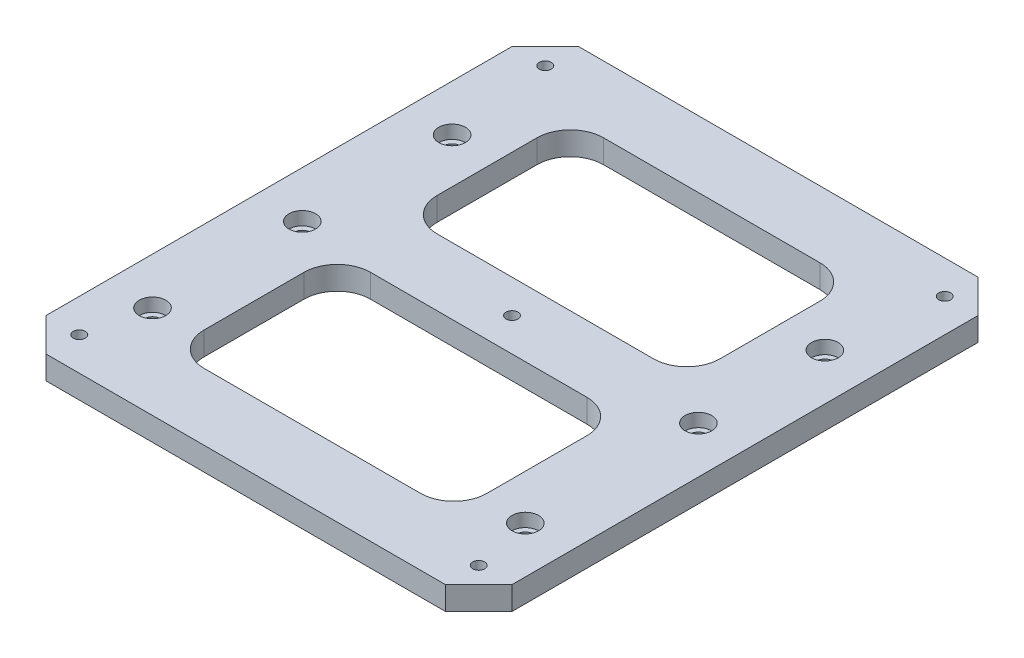
from build123d import *

# Parameters (mm, degrees)
SKETCH1_W                      = 140
SKETCH1_H                      = 160
BOSS_EXTRUDE1_DEPTH            = 7
CBORE_FOR_M4_SHCS1_D           = 4.8
CBORE_FOR_M4_SHCS1_CBORE_D     = 8
CBORE_FOR_M4_SHCS1_CBORE_DEPTH = 4
CHAMFER1_SIZE                  = 10
CUT_EXTRUDE1_REACH             = 108.532
SKETCH8_W                      = 85
SKETCH8_H                      = 120
FILLET1_R                      = 10
SKETCH9_W                      = 85
SKETCH9_H                      = 20
BOSS_EXTRUDE3_DEPTH            = 7
FILLET2_R                      = 10
M3_CLEARANCE_HOLE1_OUTLINE_R   = 1.8
M3_CLEARANCE_HOLE1_DEPTH       = 7


# Read off the part's stored shape, not the designer's step: M3 Clearance Hole1
with BuildPart() as part:
    # Sketch1 → Boss-Extrude1 (new body)
    with BuildSketch(Plane(origin=(0, 0, 0), x_dir=(1, 0, 0), z_dir=(0, 1, 0))):
        Rectangle(SKETCH1_W, SKETCH1_H)
    extrude(amount=BOSS_EXTRUDE1_DEPTH)

    # CBORE for M4 SHCS1 (through all)
    with Locations(Plane(origin=(0, 7, 0), x_dir=(1, 0, 0), z_dir=(0, 1, 0))):
        with Locations((-56, 38), (56, 38), (-56, -7), (56, 0), (-56, -52), (56, -52)):
            CounterBoreHole(CBORE_FOR_M4_SHCS1_D / 2, CBORE_FOR_M4_SHCS1_CBORE_D / 2, CBORE_FOR_M4_SHCS1_CBORE_DEPTH)

    # Chamfer1
    chamfer1_edges = [part.edges().sort_by_distance(p)[0] for p in [
        (70, 3.5, 80),
        (-70, 3.5, 80),
        (-70, 3.5, -80),
        (70, 3.5, -80),
    ]]
    chamfer(chamfer1_edges, length=CHAMFER1_SIZE)

    # Sketch8 → Cut-Extrude1 (cut, up to next)
    with BuildSketch(Plane.XZ, mode=Mode.PRIVATE) as cut_extrude1_sk1:
        Rectangle(SKETCH8_W, SKETCH8_H)
    cut_extrude1_tool1 = extrude(cut_extrude1_sk1.sketch, amount=-CUT_EXTRUDE1_REACH, mode=Mode.PRIVATE) & part.part
    add(cut_extrude1_tool1.solids().sort_by_distance((0, 0, 0))[0], mode=Mode.SUBTRACT)

    # Fillet1
    fillet1_edges = [part.edges().sort_by_distance(p)[0] for p in [
        (-42.5, 3.5, -60),
        (-42.5, 3.5, 60),
        (42.5, 3.5, 60),
        (42.5, 3.5, -60),
    ]]
    fillet(fillet1_edges, radius=FILLET1_R)

    # Sketch9 → Boss-Extrude3 (add)
    with BuildSketch(Plane.XZ):
        Rectangle(SKETCH9_W, SKETCH9_H)
    extrude(amount=-BOSS_EXTRUDE3_DEPTH)

    # Fillet2
    fillet2_edges = [part.edges().sort_by_distance(p)[0] for p in [
        (42.5, 3.5, 10),
        (42.5, 3.5, -10),
        (-42.5, 3.5, -10),
        (-42.5, 3.5, 10),
    ]]
    fillet(fillet2_edges, radius=FILLET2_R)

    # M3 Clearance Hole1 outline → M3 Clearance Hole1 (cut)
    with BuildSketch(Plane(origin=(0, 0, 0), x_dir=(1, 0, 0), z_dir=(0, 1, 0))):
        with Locations((60, -70)):
            Circle(M3_CLEARANCE_HOLE1_OUTLINE_R)
        with Locations((-60, 70)):
            Circle(M3_CLEARANCE_HOLE1_OUTLINE_R)
        with Locations((-60, -70)):
            Circle(M3_CLEARANCE_HOLE1_OUTLINE_R)
        with Locations((60, 70)):
            Circle(M3_CLEARANCE_HOLE1_OUTLINE_R)
        Circle(M3_CLEARANCE_HOLE1_OUTLINE_R)
    extrude(amount=M3_CLEARANCE_HOLE1_DEPTH, mode=Mode.SUBTRACT)


solid = part.part
